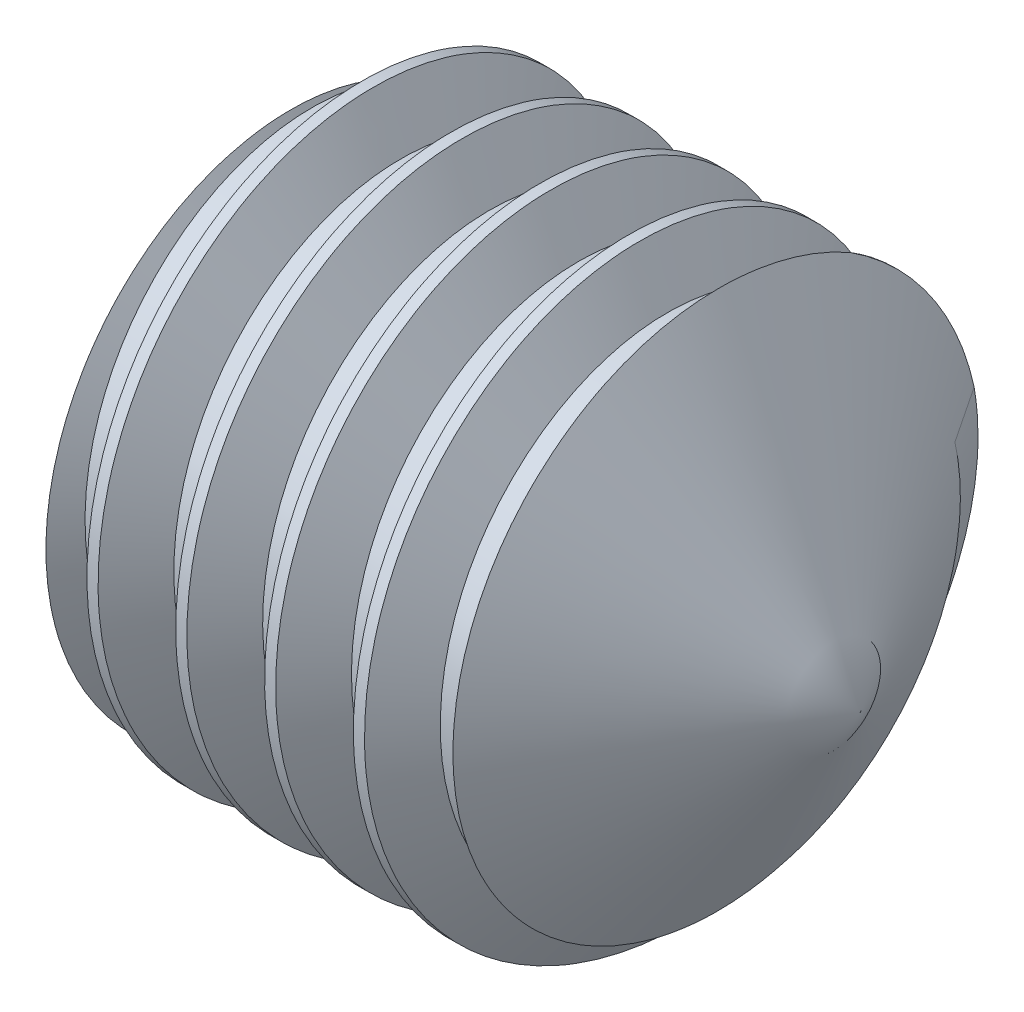
from build123d import *

# Parameters (mm, degrees)
HEX_2_DEPTH   = 3
THREAD2_PITCH = 1.25


with BuildPart() as part:
    # BodySke → BaseBody (revolve)
    with BuildSketch(Plane.XY, mode=Mode.PRIVATE) as basebody_sk:
        Polygon((0, 0), (0, 3.3095), (0.398660361, 4), (5.690598923, 4), (8, 0), align=None)
    revolve(basebody_sk.sketch.rotate(Axis((-12.7, 0, 0), (1, 0, 0)), 90), axis=Axis((-12.7, 0, 0), (1, 0, 0)))

    # Sketch2 → Hex 2 (cut)
    with BuildSketch(Plane.ZY):
        Polygon((1.154700538, 2), (-1.154700538, 2), (-2.309401077, 0), (-1.154700538, -2), (1.154700538, -2), (2.309401077, 0), align=None)
    extrude(amount=-HEX_2_DEPTH, mode=Mode.SUBTRACT)

    # Thread2: the profile of Thread Profile2 profile screwed along a right-hand helix of 8 turns, 8 arcs to a turn; built about Z, then put on its axis
    thread2_z = Axis((0, 0, 0), (0, 0, 1))
    thread2_corners = [(4.0003, 0, -0.000173205), (4.0003, 0, 1.093923202), (3.323417656, 0, 0.703124998), (3.323417656, 0, 0.390624998)]
    with BuildLine(mode=Mode.PRIVATE) as thread2_profile:
        Line(thread2_corners[0], thread2_corners[1])
        Line(thread2_corners[1], thread2_corners[2])
        Line(thread2_corners[2], thread2_corners[3])
        Line(thread2_corners[3], thread2_corners[0])
    thread2_cap = Face(thread2_profile.wire())
    thread2_turn_angles = [0, 22.5, 45, 67.5, 90, 112.5, 135, 157.5, 180, 202.5, 225, 247.5, 270, 292.5, 315, 337.5, 360]
    thread2_turn_weights = [1, 0.9238795325112867, 1, 0.9238795325112867, 1, 0.9238795325112867, 1, 0.9238795325112867, 1, 0.9238795325112867, 1, 0.9238795325112867, 1, 0.9238795325112867, 1, 0.9238795325112867, 1]
    thread2_turn_rails = [Edge.make_bspline([Vector(p[0], p[1], 0).rotate(thread2_z, thread2_turn_angles[k]) / thread2_turn_weights[k] + Vector(0, 0, p[2] + THREAD2_PITCH * thread2_turn_angles[k] / 360) for k in range(17)], [0, 0, 0, 1, 1, 2, 2, 3, 3, 4, 4, 5, 5, 6, 6, 7, 7, 8, 8, 8], 2, thread2_turn_weights) for p in thread2_corners]
    thread2_turn_sides = [Face.make_surface_from_curves(thread2_turn_rails[p[0]], thread2_turn_rails[p[1]]) for p in [(0, 1), (1, 2), (2, 3), (3, 0)]]
    thread2 = Plane(origin=(-0.601339639, 0, 0), x_dir=(0, 0, -1), z_dir=(1, 0, 0)) * Solid(Shell([*[p.moved(Location((0, 0, THREAD2_PITCH * i))) for i in range(8) for p in thread2_turn_sides], thread2_cap, thread2_cap.rotate(thread2_z, 2880).moved(Location((0, 0, THREAD2_PITCH * 2880 / 360)))]))
    add(thread2, mode=Mode.SUBTRACT)


solid = part.part
